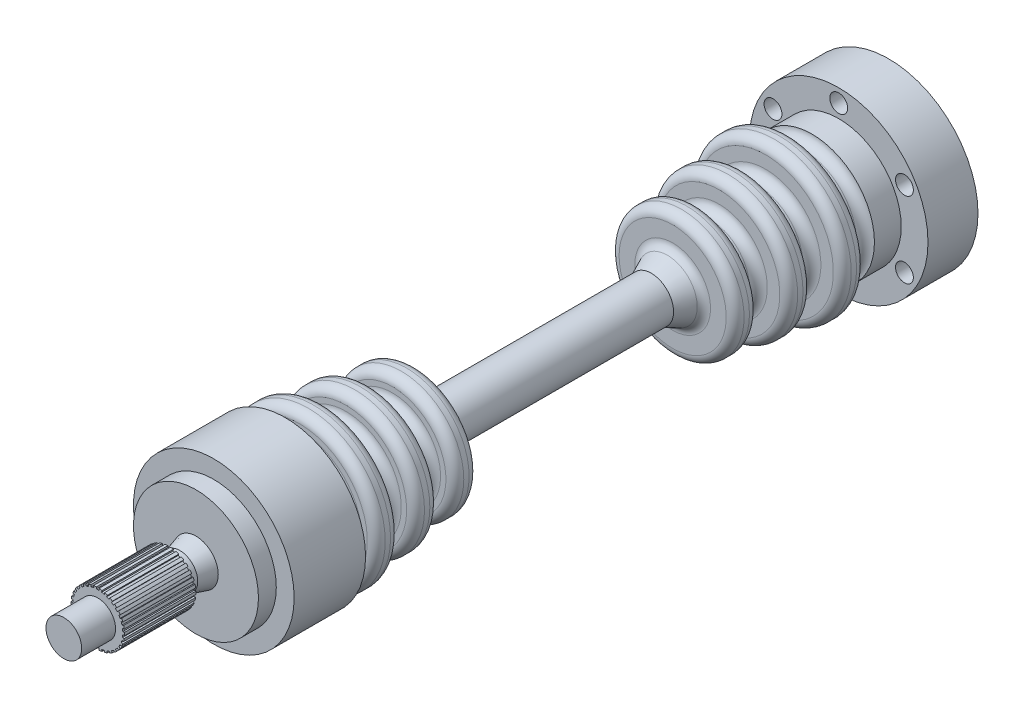
from build123d import *

# Parameters (mm, degrees)
SZKIC1_R                    = 35
DODANIE_WYCI_GNI_CIE1_DEPTH = 10
SZKIC2_R                    = 50
DODANIE_WYCI_GNI_CIE2_DEPTH = 28
SZKIC3_R                    = 5
WYTNIJ_WYCI_GNI_CIE1_DEPTH  = 77.052613367
SZYK_KO_OWY1_COUNT          = 6
SZKIC6_R                    = 35
DODANIE_WYCI_GNI_CIE4_DEPTH = 15
ZAOKR_GLENIE1_R             = 5
SZKIC7_R                    = 12.5
DODANIE_WYCI_GNI_CIE5_DEPTH = 120
ZAOKR_GLENIE1_OF_LUSTRO1_R  = 5
SZKIC8_R                    = 45
DODANIE_WYCI_GNI_CIE6_DEPTH = 40
SZKIC10_R                   = 35
DODANIE_WYCI_GNI_CIE7_DEPTH = 10
SZKIC11_R                   = 15
DODANIE_WYCI_GNI_CIE8_DEPTH = 40
WYTNIJ_WYCI_GNI_CIE2_REACH  = 460.486
SZKIC12_W                   = 1.5
SZKIC12_H                   = 2
SZYK_KO_OWY2_COUNT          = 30
DODANIE_WYCI_GNI_CIE9_START = 19
SZKIC13_R                   = 10
DODANIE_WYCI_GNI_CIE9_DEPTH = 19


with BuildPart() as part:
    # Szkic1 → Dodanie-wyciągnięcie1 (new body)
    with BuildSketch(Plane.XY):
        Circle(SZKIC1_R)
    extrude(amount=DODANIE_WYCI_GNI_CIE1_DEPTH)

    # Szkic2 → Dodanie-wyciągnięcie2 (add)
    with BuildSketch(Plane.XY.offset(10)):
        Circle(SZKIC2_R)
    extrude(amount=DODANIE_WYCI_GNI_CIE2_DEPTH)

    # Szkic3 → Wytnij-wyciągnięcie1 (cut, through all)
    with BuildSketch(Plane(origin=(0, 0, 10), x_dir=(-1, 0, 0), z_dir=(0, 0, -1))):
        with Locations((0, 42.5)):
            Circle(SZKIC3_R)
    wytnij_wyci_gni_cie1 = extrude(amount=-WYTNIJ_WYCI_GNI_CIE1_DEPTH, mode=Mode.SUBTRACT)

    # Szyk kołowy1: Wytnij-wyciągnięcie1 ×6 about axis
    szyk_ko_owy1_axis = Axis((0, 0, 0), (0, 0, 1))
    for i in range(1, SZYK_KO_OWY1_COUNT):
        add(wytnij_wyci_gni_cie1.rotate(szyk_ko_owy1_axis, i * 360 / SZYK_KO_OWY1_COUNT), mode=Mode.SUBTRACT)

    # Szkic6 → Dodanie-wyciągnięcie4 (add)
    with BuildSketch(Plane.XY.offset(38)):
        Circle(SZKIC6_R)
    extrude(amount=DODANIE_WYCI_GNI_CIE4_DEPTH)

    # Szkic4 → Obrót1 (revolve)
    with BuildSketch(Plane(origin=(0, 0, 0), x_dir=(0, 0, -1), z_dir=(1, 0, 0)), mode=Mode.PRIVATE) as obr_t1_sk:
        Polygon((-53, 30), (-66, 30), (-66, 43), (-79, 43), (-79, 26), (-92, 26), (-92, 39), (-105, 39), (-105, 22), (-118, 22), (-118, 35), (-131, 35), (-131, 18), (-143, 12.5), (-143, 0), (-53, 0), align=None)
    obr_t1 = revolve(obr_t1_sk.sketch.rotate(Axis((0, 0, 143), (0, 0, -1)), 90), axis=Axis((0, 0, 143), (0, 0, -1)))

    # Zaokrąglenie1
    zaokr_glenie1_edges = [part.edges().sort_by_distance(p)[0] for p in [
        (-30, 0, 53),
        (-30, 0, 66),
        (-43, 0, 66),
        (-43, 0, 79),
        (-26, 0, 79),
        (-26, 0, 92),
        (-39, 0, 92),
        (-39, 0, 105),
        (-22, 0, 105),
        (-22, 0, 118),
        (-35, 0, 118),
        (-35, 0, 131),
        (-18, 0, 131),
    ]]
    fillet(zaokr_glenie1_edges, radius=ZAOKR_GLENIE1_R - 0.0001)  # a hair under: the kernel refuses the full size

    # Szkic7 → Dodanie-wyciągnięcie5 (add)
    with BuildSketch(Plane.XY.offset(143)):
        Circle(SZKIC7_R)
    extrude(amount=DODANIE_WYCI_GNI_CIE5_DEPTH)

    # Lustro1: Obrót1 across plane
    add(obr_t1.mirror(Plane.XY.offset(203)))

    # Zaokrąglenie1 of Lustro1
    zaokr_glenie1_of_lustro1_edges = [part.edges().sort_by_distance(p)[0] for p in [
        (-30, 0, 353),
        (-30, 0, 340),
        (-43, 0, 340),
        (-43, 0, 327),
        (-26, 0, 327),
        (-26, 0, 314),
        (-39, 0, 314),
        (-39, 0, 301),
        (-22, 0, 301),
        (-22, 0, 288),
        (-35, 0, 288),
        (-35, 0, 275),
        (-18, 0, 275),
    ]]
    fillet(zaokr_glenie1_of_lustro1_edges, radius=ZAOKR_GLENIE1_OF_LUSTRO1_R - 0.0001)  # a hair under: the kernel refuses the full size

    # Szkic8 → Dodanie-wyciągnięcie6 (add)
    with BuildSketch(Plane.XY.offset(348)):
        Circle(SZKIC8_R)
    extrude(amount=DODANIE_WYCI_GNI_CIE6_DEPTH)

    # Szkic10 → Dodanie-wyciągnięcie7 (add)
    with BuildSketch(Plane.XY.offset(388)):
        Circle(SZKIC10_R)
    extrude(amount=DODANIE_WYCI_GNI_CIE7_DEPTH)

    # Szkic9 → Obrót2 (revolve)
    with BuildSketch(Plane(origin=(0, 0, 0), x_dir=(0, 0, -1), z_dir=(1, 0, 0)), mode=Mode.PRIVATE) as obr_t2_sk:
        Polygon((-398, 12.5), (-407, 10), (-413, 10), (-413, 0), (-398, 0), align=None)
    revolve(obr_t2_sk.sketch.rotate(Axis((0, 0, 413), (0, 0, -1)), 90), axis=Axis((0, 0, 413), (0, 0, -1)))

    # Szkic11 → Dodanie-wyciągnięcie8 (add)
    with BuildSketch(Plane.XY.offset(413)):
        Circle(SZKIC11_R)
    extrude(amount=DODANIE_WYCI_GNI_CIE8_DEPTH)

    # Szkic12 → Wytnij-wyciągnięcie2 (cut, up to next)
    with BuildSketch(Plane.XY.offset(453), mode=Mode.PRIVATE) as wytnij_wyci_gni_cie2_sk1:
        with Locations((0, 15)):
            Rectangle(SZKIC12_W, SZKIC12_H)
    wytnij_wyci_gni_cie2_tool1 = extrude(wytnij_wyci_gni_cie2_sk1.sketch, amount=-WYTNIJ_WYCI_GNI_CIE2_REACH, mode=Mode.PRIVATE) & part.part
    wytnij_wyci_gni_cie2 = wytnij_wyci_gni_cie2_tool1.solids().sort_by_distance((0, 15, 453))[0]
    add(wytnij_wyci_gni_cie2, mode=Mode.SUBTRACT)

    # Szyk kołowy2: Wytnij-wyciągnięcie2 ×30 about axis
    szyk_ko_owy2_axis = Axis((0, -0.030635616, 0), (0, 0, 1))
    for i in range(1, SZYK_KO_OWY2_COUNT):
        add(wytnij_wyci_gni_cie2.rotate(szyk_ko_owy2_axis, i * 360 / SZYK_KO_OWY2_COUNT), mode=Mode.SUBTRACT)

    # Szkic13 → Dodanie-wyciągnięcie9 (add)
    with BuildSketch(Plane.XY.offset(453).offset(DODANIE_WYCI_GNI_CIE9_START)):
        Circle(SZKIC13_R)
    extrude(amount=-DODANIE_WYCI_GNI_CIE9_DEPTH)


solid = part.part
